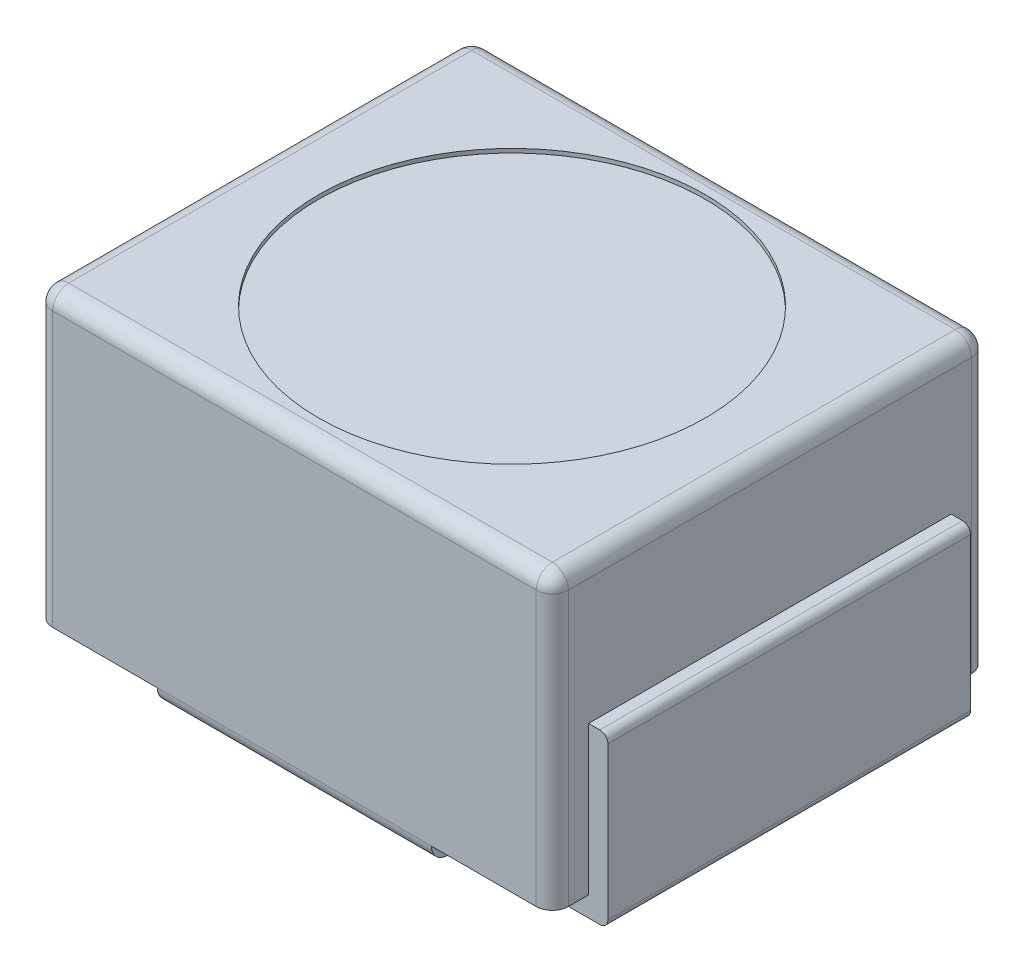
from build123d import *

# Parameters (mm, degrees)
SKETCH_2_W          = 3.2
SKETCH_2_H          = 2.7
EXTRUDE_1_DEPTH     = 1.9
FILLET_1_R          = 0.1
FILLET_2_R          = 0.1
FILLET_3_R          = 0.1
FILLET_4_R          = 0.1
FILLET_5_R          = 0.1
SKETCH_3_R          = 1.2
CUT_EXTRUDE_1_DEPTH = 0.025
SKETCH_4_W          = 0.827754981
SKETCH_4_H          = 2.835918068
CUT_EXTRUDE_2_DEPTH = 0.1
EXTRUDE_3_DEPTH     = 1.125


with BuildPart() as part:
    # Эскиз2 → Бобышка-Вытянуть1 (new body)
    with BuildSketch(Plane(origin=(0, 0, 0), x_dir=(1, 0, 0), z_dir=(0, 1, 0))):
        Rectangle(SKETCH_2_W, SKETCH_2_H)
    extrude(amount=EXTRUDE_1_DEPTH)

    # Скругление1
    fillet_1_edges = [part.edges().sort_by_distance(p)[0] for p in [
        (-1.6, 1.9, 0),
        (0, 1.9, 1.35),
        (1.6, 1.9, 0),
        (0, 1.9, -1.35),
    ]]
    fillet(fillet_1_edges, radius=FILLET_1_R)

    # Скругление2
    # the kernel refuses this fillet: 0.1 mm, written as the material it takes off along each edge
    with BuildSketch(Plane(origin=(-1.5, 1.8, 1.25), x_dir=(0, 0, 1), z_dir=(-1, 0, 0))) as fillet_2_piece_1_section:
        Polygon((0, 0), (FILLET_2_R, 0), (FILLET_2_R, FILLET_2_R), (0, FILLET_2_R), align=None)
    fillet_2_piece_1 = extrude(amount=FILLET_2_R, mode=Mode.PRIVATE)
    fillet_2_piece_1 = fillet_2_piece_1 - Plane(origin=(-1.5, 1.8, 1.25), x_dir=(0, -0.7071067811865475, -0.7071067811865475), z_dir=(-1, 0, 0)) * Sphere(FILLET_2_R, mode=Mode.PRIVATE)
    add(fillet_2_piece_1, mode=Mode.SUBTRACT)
    with BuildSketch(Plane(origin=(1.5, 1.8, 1.25), x_dir=(0, 0, 1), z_dir=(1, 0, 0))) as fillet_2_piece_2_section:
        Polygon((0, 0), (FILLET_2_R, 0), (FILLET_2_R, -FILLET_2_R), (0, -FILLET_2_R), align=None)
    fillet_2_piece_2 = extrude(amount=FILLET_2_R, mode=Mode.PRIVATE)
    fillet_2_piece_2 = fillet_2_piece_2 - Plane(origin=(1.5, 1.8, 1.25), x_dir=(0, -0.7071067811865475, -0.7071067811865475), z_dir=(1, 0, 0)) * Sphere(FILLET_2_R, mode=Mode.PRIVATE)
    add(fillet_2_piece_2, mode=Mode.SUBTRACT)
    with BuildSketch(Plane(origin=(1.6, -0.25, 1.35), x_dir=(0, 0, -1), z_dir=(0, 1, 0))) as fillet_2_piece_3:
        with BuildLine():
            CenterArc((FILLET_2_R, FILLET_2_R), FILLET_2_R, 180, 90)
            Line((0, FILLET_2_R), (0, 0))
            Line((0, 0), (FILLET_2_R, 0))
        make_face()
    extrude(amount=2.05, mode=Mode.SUBTRACT)
    with BuildSketch(Plane(origin=(-1.6, -0.25, 1.35), x_dir=(0, 0, -1), z_dir=(0, 1, 0))) as fillet_2_piece_4:
        with BuildLine():
            CenterArc((FILLET_2_R, -FILLET_2_R), FILLET_2_R, 90, 90)
            Line((0, -FILLET_2_R), (0, 0))
            Line((0, 0), (FILLET_2_R, 0))
        make_face()
    extrude(amount=2.05, mode=Mode.SUBTRACT)
    with BuildSketch(Plane(origin=(1.85, 0, 1.35), x_dir=(0, 0, -1), z_dir=(-1, 0, 0))) as fillet_2_piece_5:
        with BuildLine():
            CenterArc((FILLET_2_R, -FILLET_2_R), FILLET_2_R, 90, 90)
            Line((0, -FILLET_2_R), (0, 0))
            Line((0, 0), (FILLET_2_R, 0))
        make_face()
    extrude(amount=3.7, mode=Mode.SUBTRACT)

    # Скругление3
    # the kernel refuses this fillet: 0.1 mm, written as the material it takes off along each edge
    with BuildSketch(Plane(origin=(1.5, 1.8, -1.25), x_dir=(1, 0, 0), z_dir=(0, 0, -1))) as fillet_3_piece_1_section:
        Polygon((0, 0), (FILLET_3_R, 0), (FILLET_3_R, -FILLET_3_R), (0, -FILLET_3_R), align=None)
    fillet_3_piece_1 = extrude(amount=FILLET_3_R, mode=Mode.PRIVATE)
    fillet_3_piece_1 = fillet_3_piece_1 - Plane(origin=(1.5, 1.8, -1.25), x_dir=(-0.7071067811865475, -0.7071067811865475, 0), z_dir=(0, 0, -1)) * Sphere(FILLET_3_R, mode=Mode.PRIVATE)
    add(fillet_3_piece_1, mode=Mode.SUBTRACT)
    with BuildSketch(Plane(origin=(1.5, 0.1, 1.25), x_dir=(1, 0, 0), z_dir=(0, -1, 0))) as fillet_3_piece_2_section:
        Polygon((0, 0), (FILLET_3_R, 0), (FILLET_3_R, FILLET_3_R), (0, FILLET_3_R), align=None)
    fillet_3_piece_2 = extrude(amount=FILLET_3_R, mode=Mode.PRIVATE)
    fillet_3_piece_2 = fillet_3_piece_2 - Plane(origin=(1.5, 0.1, 1.25), x_dir=(-0.7071067811865476, 0, -0.7071067811865475), z_dir=(0, -1, 0)) * Sphere(FILLET_3_R, mode=Mode.PRIVATE)
    add(fillet_3_piece_2, mode=Mode.SUBTRACT)
    with BuildSketch(Plane(origin=(1.6, -0.25, -1.35), x_dir=(-1, 0, 0), z_dir=(0, 1, 0))) as fillet_3_piece_3:
        with BuildLine():
            CenterArc((FILLET_3_R, FILLET_3_R), FILLET_3_R, 180, 90)
            Line((0, FILLET_3_R), (0, 0))
            Line((0, 0), (FILLET_3_R, 0))
        make_face()
    extrude(amount=2.05, mode=Mode.SUBTRACT)
    with BuildSketch(Plane(origin=(1.6, 0, -1.6), x_dir=(-1, 0, 0), z_dir=(0, 0, 1))) as fillet_3_piece_4:
        with BuildLine():
            CenterArc((FILLET_3_R, -FILLET_3_R), FILLET_3_R, 90, 90)
            Line((0, -FILLET_3_R), (0, 0))
            Line((0, 0), (FILLET_3_R, 0))
        make_face()
    extrude(amount=2.85, mode=Mode.SUBTRACT)

    # Скругление4
    # the kernel refuses this fillet: 0.1 mm, written as the material it takes off along each edge
    with BuildSketch(Plane(origin=(-1.5, 1.8, -1.25), x_dir=(-1, 0, 0), z_dir=(0, 0, -1))) as fillet_4_piece_1_section:
        Polygon((0, 0), (FILLET_4_R, 0), (FILLET_4_R, FILLET_4_R), (0, FILLET_4_R), align=None)
    fillet_4_piece_1 = extrude(amount=FILLET_4_R, mode=Mode.PRIVATE)
    fillet_4_piece_1 = fillet_4_piece_1 - Plane(origin=(-1.5, 1.8, -1.25), x_dir=(0.7071067811865475, -0.7071067811865475, 0), z_dir=(0, 0, -1)) * Sphere(FILLET_4_R, mode=Mode.PRIVATE)
    add(fillet_4_piece_1, mode=Mode.SUBTRACT)
    with BuildSketch(Plane(origin=(1.5, 0.1, -1.25), x_dir=(0, -1, 0), z_dir=(0, 0, -1))) as fillet_4_piece_2_section:
        Polygon((0, 0), (FILLET_4_R, 0), (FILLET_4_R, -FILLET_4_R), (0, -FILLET_4_R), align=None)
    fillet_4_piece_2 = extrude(amount=FILLET_4_R, mode=Mode.PRIVATE)
    fillet_4_piece_2 = fillet_4_piece_2 - Plane(origin=(1.5, 0.1, -1.25), x_dir=(-0.7071067811865475, 0.7071067811865475, 0), z_dir=(0, 0, -1)) * Sphere(FILLET_4_R, mode=Mode.PRIVATE)
    add(fillet_4_piece_2, mode=Mode.SUBTRACT)
    with BuildSketch(Plane(origin=(-1.6, -0.25, -1.35), x_dir=(1, 0, 0), z_dir=(0, 1, 0))) as fillet_4_piece_3:
        with BuildLine():
            CenterArc((FILLET_4_R, -FILLET_4_R), FILLET_4_R, 90, 90)
            Line((0, -FILLET_4_R), (0, 0))
            Line((0, 0), (FILLET_4_R, 0))
        make_face()
    extrude(amount=2.05, mode=Mode.SUBTRACT)
    with BuildSketch(Plane(origin=(-1.85, 0, -1.35), x_dir=(0, 1, 0), z_dir=(1, 0, 0))) as fillet_4_piece_4:
        with BuildLine():
            CenterArc((FILLET_4_R, FILLET_4_R), FILLET_4_R, 180, 90)
            Line((0, FILLET_4_R), (0, 0))
            Line((0, 0), (FILLET_4_R, 0))
        make_face()
    extrude(amount=3.35, mode=Mode.SUBTRACT)

    # Скругление5
    # the kernel refuses this fillet: 0.1 mm, written as the material it takes off along each edge
    with BuildSketch(Plane(origin=(-1.5, 0.1, 1.25), x_dir=(-1, 0, 0), z_dir=(0, -1, 0))) as fillet_5_piece_1_section:
        Polygon((0, 0), (FILLET_5_R, 0), (FILLET_5_R, -FILLET_5_R), (0, -FILLET_5_R), align=None)
    fillet_5_piece_1 = extrude(amount=FILLET_5_R, mode=Mode.PRIVATE)
    fillet_5_piece_1 = fillet_5_piece_1 - Plane(origin=(-1.5, 0.1, 1.25), x_dir=(0.7071067811865475, 0, -0.7071067811865477), z_dir=(0, -1, 0)) * Sphere(FILLET_5_R, mode=Mode.PRIVATE)
    add(fillet_5_piece_1, mode=Mode.SUBTRACT)
    with BuildSketch(Plane(origin=(-1.5, 0.1, -1.25), x_dir=(-1, 0, 0), z_dir=(0, -1, 0))) as fillet_5_piece_2_section:
        Polygon((0, 0), (FILLET_5_R, 0), (FILLET_5_R, FILLET_5_R), (0, FILLET_5_R), align=None)
    fillet_5_piece_2 = extrude(amount=FILLET_5_R, mode=Mode.PRIVATE)
    fillet_5_piece_2 = fillet_5_piece_2 - Plane(origin=(-1.5, 0.1, -1.25), x_dir=(0.7071067811865476, 0, 0.7071067811865475), z_dir=(0, -1, 0)) * Sphere(FILLET_5_R, mode=Mode.PRIVATE)
    add(fillet_5_piece_2, mode=Mode.SUBTRACT)
    with BuildSketch(Plane(origin=(-1.6, 0, 1.25), x_dir=(1, 0, 0), z_dir=(0, 0, -1))) as fillet_5_piece_3:
        with BuildLine():
            CenterArc((FILLET_5_R, -FILLET_5_R), FILLET_5_R, 90, 90)
            Line((0, -FILLET_5_R), (0, 0))
            Line((0, 0), (FILLET_5_R, 0))
        make_face()
    extrude(amount=2.5, mode=Mode.SUBTRACT)

    # Эскиз3 → Вырез-Вытянуть1 (cut)
    with BuildSketch(Plane(origin=(0, 1.9, 0), x_dir=(1, 0, 0), z_dir=(0, 1, 0))):
        with Locations(Location((0, 0, 0), (0, 0, 270))):
            Circle(SKETCH_3_R)
    extrude(amount=-CUT_EXTRUDE_1_DEPTH, mode=Mode.SUBTRACT)

    # Эскиз4 → Вырез-Вытянуть2 (cut)
    with BuildSketch(Plane.XZ):
        with Locations((1.263877491, 0.001548995)):
            Rectangle(SKETCH_4_W, SKETCH_4_H)
        with Locations((-1.263877491, 0.001548995)):
            Rectangle(SKETCH_4_W, SKETCH_4_H)
    extrude(amount=-CUT_EXTRUDE_2_DEPTH, mode=Mode.SUBTRACT)

    # Эскиз6 → Бобышка-Вытянуть3 (add, symmetric)
    with BuildSketch(Plane(origin=(0, 0, 0), x_dir=(-1, 0, 0), z_dir=(0, 0, -1))):
        with BuildLine():
            Line((1.6, 0.1), (0.87063337, 0.1))
            Line((0.87063337, 0.1), (0.87063337, 0.025437095))
            ThreePointArc((0.87063337, 0.025437095), (0.885278031, -0.009918244), (0.92063337, -0.024562905))
            Line((0.92063337, -0.024562905), (1.67, -0.024562905))
            ThreePointArc((1.67, -0.024562905), (1.705355339, -0.009918244), (1.72, 0.025437095))
            Line((1.72, 0.025437095), (1.72, 0.971300934))
            ThreePointArc((1.72, 0.971300934), (1.705355339, 1.006656273), (1.67, 1.021300934))
            Line((1.67, 1.021300934), (1.6, 1.021300934))
            Line((1.6, 1.021300934), (1.6, 0.1))
        make_face()
        with BuildLine():
            Line((-1.6, 1.021300934), (-1.67, 1.021300934))
            ThreePointArc((-1.67, 1.021300934), (-1.705355339, 1.006656273), (-1.72, 0.971300934))
            Line((-1.72, 0.971300934), (-1.72, 0.025437095))
            ThreePointArc((-1.72, 0.025437095), (-1.705355339, -0.009918244), (-1.67, -0.024562905))
            Line((-1.67, -0.024562905), (-0.92063337, -0.024562905))
            ThreePointArc((-0.92063337, -0.024562905), (-0.885278031, -0.009918244), (-0.87063337, 0.025437095))
            Line((-0.87063337, 0.025437095), (-0.87063337, 0.1))
            Line((-0.87063337, 0.1), (-1.6, 0.1))
            Line((-1.6, 0.1), (-1.6, 1.021300934))
        make_face()
    extrude(amount=EXTRUDE_3_DEPTH, both=True)


solid = part.part
